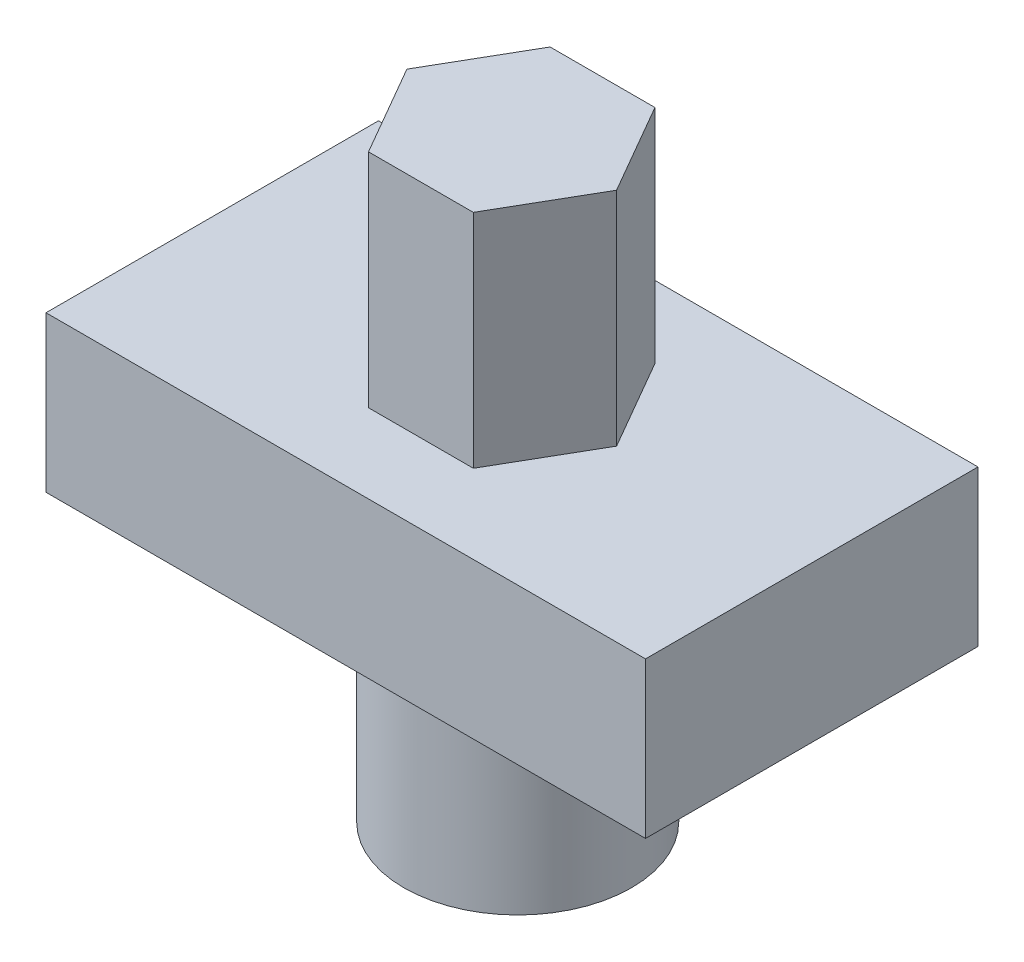
from build123d import *

# Parameters (mm, degrees)
SKETCH1_W           = 137.407001984
SKETCH1_H           = 35.641957088
BOSS_EXTRUDE1_DEPTH = 76.2
BOSS_EXTRUDE2_DEPTH = 50.8
SKETCH3_R           = 26.099786647
BOSS_EXTRUDE3_DEPTH = 50.8


with BuildPart() as part:
    # Sketch1 → Boss-Extrude1 (new body)
    with BuildSketch(Plane.XY):
        Rectangle(SKETCH1_W, SKETCH1_H)
    extrude(amount=BOSS_EXTRUDE1_DEPTH)

    # Sketch2 → Boss-Extrude2 (add)
    with BuildSketch(Plane(origin=(0, 17.820978544, 0), x_dir=(1, 0, 0), z_dir=(0, 1, 0))):
        Polygon((23.159003861, -37.290679973), (11.143714224, -16.479587852), (-12.886865052, -16.479587852), (-24.90215469, -37.290679973), (-12.886865052, -58.101772093), (11.143714224, -58.101772093), align=None)
    extrude(amount=BOSS_EXTRUDE2_DEPTH)

    # Sketch3 → Boss-Extrude3 (add)
    with BuildSketch(Plane.XZ.offset(17.820978544)):
        with Locations((0, 36.792636879)):
            Circle(SKETCH3_R)
    extrude(amount=BOSS_EXTRUDE3_DEPTH)


solid = part.part
